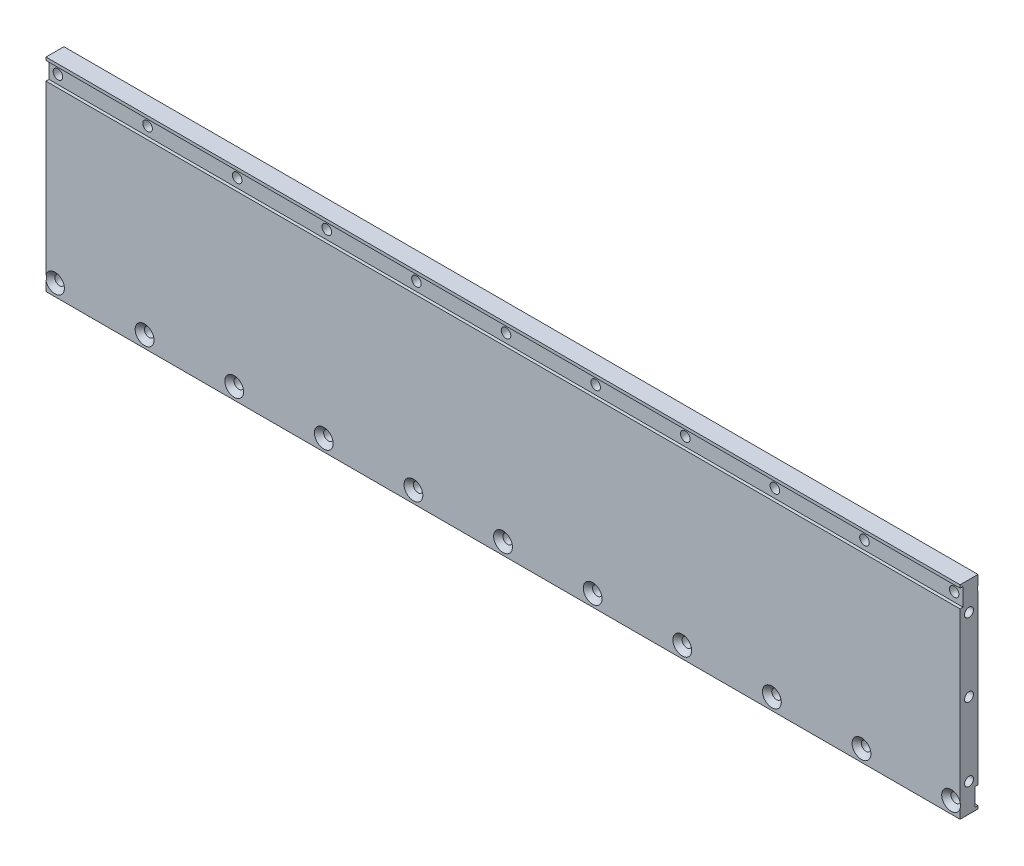
from build123d import *

# Parameters (mm, degrees)
SKETCH_1_W                     = 306
SKETCH_1_H                     = 68
EXTRUDE_1_DEPTH                = 3
CUT_EXTRUDE_START              = 3
SKETCH_1_3_W                   = 306
SKETCH_1_3_H                   = 6
CUT_EXTRUDE_1_DEPTH            = 1
CUT_EXTRUDE_START_2            = -3
SKETCH_1_4_W                   = 306
SKETCH_1_4_H                   = 6
CUT_EXTRUDE_2_DEPTH            = 1
HOLE_START                     = -4
HOLE_WIZARD_M3_1_OUTLINE_R     = 1.6
HOLE_WIZARD_M3_1_DEPTH         = 8
M3X0_5_1_D                     = 2.5
M3X0_5_1_DEPTH                 = 8.5
M3X0_5_1_CBORE_D               = 3
M3X0_5_1_CBORE_DEPTH           = 6
M3X0_5_1_TIP                   = 0.751075774
M3X0_5_1_ON_FACE_2_D           = 2.5
M3X0_5_1_ON_FACE_2_DEPTH       = 8.5
M3X0_5_1_ON_FACE_2_CBORE_D     = 3
M3X0_5_1_ON_FACE_2_CBORE_DEPTH = 6
M3X0_5_1_ON_FACE_2_TIP         = 0.751075774
PATTERN_LINEAR_1_COUNT         = 11
PATTERN_LINEAR_1_PITCH         = 30


with BuildPart() as part:
    # ｽｹｯﾁ1 → ﾎﾞｽ - 押し出し1 (new, symmetric)
    with BuildSketch(Plane.XY):
        Rectangle(SKETCH_1_W, SKETCH_1_H)
    extrude(amount=EXTRUDE_1_DEPTH, both=True)

    # ｽｹｯﾁ1<3> → ｶｯﾄ - 押し出し1 (cut)
    with BuildSketch(Plane.XY.offset(CUT_EXTRUDE_START)):
        with Locations((0, 30)):
            Rectangle(SKETCH_1_3_W, SKETCH_1_3_H)
    extrude(amount=-CUT_EXTRUDE_1_DEPTH, mode=Mode.SUBTRACT)

    # ｽｹｯﾁ1<4> → ｶｯﾄ - 押し出し2 (cut)
    with BuildSketch(Plane.XY.offset(CUT_EXTRUDE_START_2)):
        with Locations((0, -30)):
            Rectangle(SKETCH_1_4_W, SKETCH_1_4_H)
    extrude(amount=CUT_EXTRUDE_2_DEPTH, mode=Mode.SUBTRACT)

    # M3 丸皿ねじ用皿穴1: read off the stored shape, not the designer's step
    # M3 丸皿ねじ用皿穴1 outline → M3 丸皿ねじ用皿穴1 (cut)
    with BuildSketch(Plane.XY.offset(HOLE_START)):
        with Locations((-150, -30)):
            Circle(HOLE_WIZARD_M3_1_OUTLINE_R)
        with Locations((-150, 30)):
            Circle(HOLE_WIZARD_M3_1_OUTLINE_R)
    hole_wizard_m3_1 = extrude(amount=HOLE_WIZARD_M3_1_DEPTH, mode=Mode.SUBTRACT)

    # Hole Wizard M3 _1 2: loft between two sections, ruled curve by curve
    hole_wizard_m3_1_2_from = [
        Edge.make_three_point_arc((-148.4, -30, 1.45), (-150, -28.4, 1.45), (-151.6, -30, 1.45)),
        Edge.make_three_point_arc((-151.6, -30, 1.45), (-150, -31.6, 1.45), (-148.4, -30, 1.45)),
    ]
    hole_wizard_m3_1_2_to = [
        Edge.make_three_point_arc((-146.849999512, -30, 3.000000488), (-150, -26.849999512, 3.000000488), (-153.150000488, -30, 3.000000488)),
        Edge.make_three_point_arc((-153.150000488, -30, 3.000000488), (-150, -33.150000488, 3.000000488), (-146.849999512, -30, 3.000000488)),
    ]
    hole_wizard_m3_1_2 = Solid(Shell([*[Face.make_surface_from_curves(hole_wizard_m3_1_2_from[k], hole_wizard_m3_1_2_to[k]) for k in range(2)], Face(Wire(hole_wizard_m3_1_2_from)), Face(Wire(hole_wizard_m3_1_2_to))]))
    add(hole_wizard_m3_1_2, mode=Mode.SUBTRACT)

    # Hole Wizard M3 _1 3: loft between two sections, ruled curve by curve
    hole_wizard_m3_1_3_from = [
        Edge.make_three_point_arc((-151.6, 30, -1.45), (-150, 31.6, -1.45), (-148.4, 30, -1.45)),
        Edge.make_three_point_arc((-148.4, 30, -1.45), (-150, 28.4, -1.45), (-151.6, 30, -1.45)),
    ]
    hole_wizard_m3_1_3_to = [
        Edge.make_three_point_arc((-153.150000488, 30, -3.000000488), (-150, 33.150000488, -3.000000488), (-146.849999512, 30, -3.000000488)),
        Edge.make_three_point_arc((-146.849999512, 30, -3.000000488), (-150, 26.849999512, -3.000000488), (-153.150000488, 30, -3.000000488)),
    ]
    hole_wizard_m3_1_3 = Solid(Shell([*[Face.make_surface_from_curves(hole_wizard_m3_1_3_from[k], hole_wizard_m3_1_3_to[k]) for k in range(2)], Face(Wire(hole_wizard_m3_1_3_from)), Face(Wire(hole_wizard_m3_1_3_to))]))
    add(hole_wizard_m3_1_3, mode=Mode.SUBTRACT)

    # M3x0.5 ねじ穴1
    with Locations(Plane(origin=(-153, 24.5, 0), x_dir=(0, 0, -1), z_dir=(-1, 0, 0))):
        with Locations((0, 0), (0, 49), (0, 24.5)):
            CounterBoreHole(M3X0_5_1_D / 2, M3X0_5_1_CBORE_D / 2, M3X0_5_1_CBORE_DEPTH, depth=M3X0_5_1_DEPTH)
            with Locations((0, 0, -(M3X0_5_1_DEPTH + M3X0_5_1_TIP / 2))):  # 118° drill point
                Cone(0, M3X0_5_1_D / 2, M3X0_5_1_TIP, mode=Mode.SUBTRACT)

    # M3x0.5 ねじ穴1 on face 2
    with Locations(Plane(origin=(153, 24.5, 0), x_dir=(0, 0, 1), z_dir=(1, 0, 0))):
        with Locations((0, 0), (0, 49), (0, 24.5)):
            CounterBoreHole(M3X0_5_1_ON_FACE_2_D / 2, M3X0_5_1_ON_FACE_2_CBORE_D / 2, M3X0_5_1_ON_FACE_2_CBORE_DEPTH, depth=M3X0_5_1_ON_FACE_2_DEPTH)
            with Locations((0, 0, -(M3X0_5_1_ON_FACE_2_DEPTH + M3X0_5_1_ON_FACE_2_TIP / 2))):  # 118° drill point
                Cone(0, M3X0_5_1_ON_FACE_2_D / 2, M3X0_5_1_ON_FACE_2_TIP, mode=Mode.SUBTRACT)

    # 直線ﾊﾟﾀｰﾝ1: M3 丸皿ねじ用皿穴1, Hole Wizard M3 _1 2, Hole Wizard M3 _1 3 ×11
    with Locations(*[(i * PATTERN_LINEAR_1_PITCH, 0, 0) for i in range(1, PATTERN_LINEAR_1_COUNT)]):
        add(hole_wizard_m3_1, mode=Mode.SUBTRACT)
        add(hole_wizard_m3_1_2, mode=Mode.SUBTRACT)
        add(hole_wizard_m3_1_3, mode=Mode.SUBTRACT)


solid = part.part
